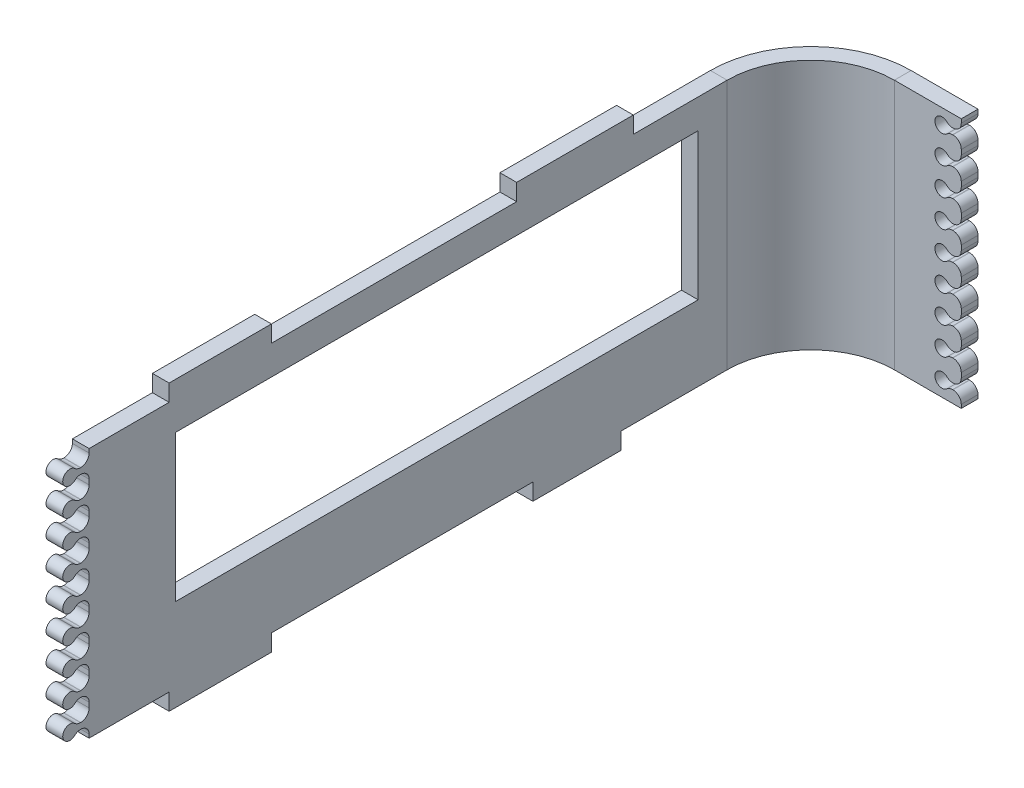
from build123d import *

# Parameters (mm, degrees)
BOSS_EXTRUDE1_DEPTH          = 5.08
EDGE_FLANGE1_STRIP_W         = 76.2
EDGE_FLANGE1_STRIP_H         = 5.08
EDGE_FLANGE1_STRIP_CUT_DEPTH = 76.2
EDGE_FLANGE1_DEPTH           = 76.2
EDGE_FLANGE1_START           = 5.08
EDGE_FLANGE1_FLAT_DEPTH      = 5.08
SKETCH8_W                    = 158.75
SKETCH8_H                    = 44.5
CUT_EXTRUDE1_DEPTH           = 242.670544012


# Sheet-metal steps are written as plain solids
with BuildPart() as part:
    # Sketch1 → Boss-Extrude1 (new body)
    with BuildSketch(Plane.XY):
        with BuildLine():
            Line((12.7, -38.1), (12.7, -37.011825379))
            ThreePointArc((12.7, -37.011825379), (11.956051224, -35.215774155), (10.16, -34.471825379))
            Line((10.16, -34.471825379), (10.028134089, -34.471825379))
            ThreePointArc((10.028134089, -34.471825379), (9.111928379, -34.642824093), (8.319084872, -35.132796169))
            ThreePointArc((8.319084872, -35.132796169), (4.69036112, -33.498380336), (8.362360336, -31.963657905))
            ThreePointArc((8.362360336, -31.963657905), (9.173613419, -32.48826627), (10.122080076, -32.6719957))
            Line((10.122080076, -32.6719957), (10.16, -32.6719957))
            ThreePointArc((10.16, -32.6719957), (11.956051224, -31.928046924), (12.7, -30.1319957))
            Line((12.7, -30.1319957), (12.7, -28.629825379))
            ThreePointArc((12.7, -28.629825379), (11.956051224, -26.833774155), (10.16, -26.089825379))
            Line((10.16, -26.089825379), (10.028134089, -26.089825379))
            ThreePointArc((10.028134089, -26.089825379), (9.111928379, -26.260824093), (8.319084872, -26.750796169))
            ThreePointArc((8.319084872, -26.750796169), (4.69036112, -25.116380336), (8.362360336, -23.581657905))
            ThreePointArc((8.362360336, -23.581657905), (9.173613419, -24.10626627), (10.122080076, -24.2899957))
            Line((10.122080076, -24.2899957), (10.16, -24.2899957))
            ThreePointArc((10.16, -24.2899957), (11.956051224, -23.546046924), (12.7, -21.7499957))
            Line((12.7, -21.7499957), (12.7, -20.247825379))
            ThreePointArc((12.7, -20.247825379), (11.956051224, -18.451774155), (10.16, -17.707825379))
            Line((10.16, -17.707825379), (10.028134089, -17.707825379))
            ThreePointArc((10.028134089, -17.707825379), (9.111928379, -17.878824093), (8.319084872, -18.368796169))
            ThreePointArc((8.319084872, -18.368796169), (4.69036112, -16.734380336), (8.362360336, -15.199657905))
            ThreePointArc((8.362360336, -15.199657905), (9.173613419, -15.72426627), (10.122080076, -15.9079957))
            Line((10.122080076, -15.9079957), (10.16, -15.9079957))
            ThreePointArc((10.16, -15.9079957), (11.956051224, -15.164046924), (12.7, -13.3679957))
            Line((12.7, -13.3679957), (12.7, -11.865825379))
            ThreePointArc((12.7, -11.865825379), (11.956051224, -10.069774155), (10.16, -9.325825379))
            Line((10.16, -9.325825379), (10.028134089, -9.325825379))
            ThreePointArc((10.028134089, -9.325825379), (9.111928379, -9.496824093), (8.319084872, -9.986796169))
            ThreePointArc((8.319084872, -9.986796169), (4.69036112, -8.352380336), (8.362360336, -6.817657905))
            ThreePointArc((8.362360336, -6.817657905), (9.173613419, -7.34226627), (10.122080076, -7.5259957))
            Line((10.122080076, -7.5259957), (10.16, -7.5259957))
            ThreePointArc((10.16, -7.5259957), (11.956051224, -6.782046924), (12.7, -4.9859957))
            Line((12.7, -4.9859957), (12.7, -3.483825379))
            ThreePointArc((12.7, -3.483825379), (11.956051224, -1.687774155), (10.16, -0.943825379))
            Line((10.16, -0.943825379), (10.028134089, -0.943825379))
            ThreePointArc((10.028134089, -0.943825379), (9.111928379, -1.114824093), (8.319084872, -1.604796169))
            ThreePointArc((8.319084872, -1.604796169), (4.69036112, 0.029619664), (8.362360336, 1.564342095))
            ThreePointArc((8.362360336, 1.564342095), (9.173613419, 1.03973373), (10.122080076, 0.8560043))
            Line((10.122080076, 0.8560043), (10.16, 0.8560043))
            ThreePointArc((10.16, 0.8560043), (11.956051224, 1.599953076), (12.7, 3.3960043))
            Line((12.7, 3.3960043), (12.7, 4.898174621))
            ThreePointArc((12.7, 4.898174621), (11.956051224, 6.694225845), (10.16, 7.438174621))
            Line((10.16, 7.438174621), (10.028134089, 7.438174621))
            ThreePointArc((10.028134089, 7.438174621), (9.111928379, 7.267175907), (8.319084872, 6.777203831))
            ThreePointArc((8.319084872, 6.777203831), (4.69036112, 8.411619664), (8.362360336, 9.946342095))
            ThreePointArc((8.362360336, 9.946342095), (9.173613419, 9.42173373), (10.122080076, 9.2380043))
            Line((10.122080076, 9.2380043), (10.16, 9.2380043))
            ThreePointArc((10.16, 9.2380043), (11.956051224, 9.981953076), (12.7, 11.7780043))
            Line((12.7, 11.7780043), (12.7, 13.280174621))
            ThreePointArc((12.7, 13.280174621), (11.956051224, 15.076225845), (10.16, 15.820174621))
            Line((10.16, 15.820174621), (10.028134089, 15.820174621))
            ThreePointArc((10.028134089, 15.820174621), (9.111928379, 15.649175907), (8.319084872, 15.159203831))
            ThreePointArc((8.319084872, 15.159203831), (4.69036112, 16.793619664), (8.362360336, 18.328342095))
            ThreePointArc((8.362360336, 18.328342095), (9.173613419, 17.80373373), (10.122080076, 17.6200043))
            Line((10.122080076, 17.6200043), (10.16, 17.6200043))
            ThreePointArc((10.16, 17.6200043), (11.956051224, 18.363953076), (12.7, 20.1600043))
            Line((12.7, 20.1600043), (12.7, 21.662174621))
            ThreePointArc((12.7, 21.662174621), (11.956051224, 23.458225845), (10.16, 24.202174621))
            Line((10.16, 24.202174621), (10.028134089, 24.202174621))
            ThreePointArc((10.028134089, 24.202174621), (9.111928379, 24.031175907), (8.319084872, 23.541203831))
            ThreePointArc((8.319084872, 23.541203831), (4.69036112, 25.175619664), (8.362360336, 26.710342095))
            ThreePointArc((8.362360336, 26.710342095), (9.173613419, 26.18573373), (10.122080076, 26.0020043))
            Line((10.122080076, 26.0020043), (10.16, 26.0020043))
            ThreePointArc((10.16, 26.0020043), (11.956051224, 26.745953076), (12.7, 28.5420043))
            Line((12.7, 28.5420043), (12.7, 30.044174621))
            ThreePointArc((12.7, 30.044174621), (11.956051224, 31.840225845), (10.16, 32.584174621))
            Line((10.16, 32.584174621), (10.028134089, 32.584174621))
            ThreePointArc((10.028134089, 32.584174621), (9.111928379, 32.413175907), (8.319084872, 31.923203831))
            ThreePointArc((8.319084872, 31.923203831), (4.69036112, 33.557619664), (8.362360336, 35.092342095))
            ThreePointArc((8.362360336, 35.092342095), (9.173613419, 34.56773373), (10.122080076, 34.3840043))
            Line((10.122080076, 34.3840043), (10.16, 34.3840043))
            ThreePointArc((10.16, 34.3840043), (11.956051224, 35.127953076), (12.7, 36.9240043))
            Line((12.7, 36.9240043), (12.7, 38.1))
            Line((12.7, 38.1), (-12.7, 38.1))
            Line((-12.7, 38.1), (-12.7, -38.1))
            Line((-12.7, -38.1), (12.7, -38.1))
        make_face()
    extrude(amount=BOSS_EXTRUDE1_DEPTH)

    # Edge-Flange1 strip (across the edge) → Edge-Flange1 strip cut (cut)
    with BuildSketch(Plane(origin=(-33.02, 38.1, 5.08), x_dir=(1, 0, 0), z_dir=(0, -1, 0))):
        with Locations((-12.7, -2.54)):
            Rectangle(EDGE_FLANGE1_STRIP_W, EDGE_FLANGE1_STRIP_H)
    extrude(amount=EDGE_FLANGE1_STRIP_CUT_DEPTH, mode=Mode.SUBTRACT)

    # Edge-Flange1 bend section (across the edge) → Edge-Flange1 (add)
    with BuildSketch(Plane(origin=(-33.02, 38.1, 5.08), x_dir=(1, 0, 0), z_dir=(0, -1, 0))):
        with BuildLine():
            Line((-5.08, 25.4), (0, 25.4))
            ThreePointArc((0, 25.4), (7.439487758, 7.439487758), (25.4, 0))
            Line((25.4, 0), (25.4, -5.08))
            ThreePointArc((25.4, -5.08), (3.847385309, 3.847385309), (-5.08, 25.4))
        make_face()
    extrude(amount=EDGE_FLANGE1_DEPTH)

    # Edge-Flange1 profile (on flange) → Edge-Flange1 flat (add)
    with BuildSketch(Plane(origin=(-33.02, 0, 5.08), x_dir=(0, -1, 0), z_dir=(-1, 0, 0)).offset(EDGE_FLANGE1_START)):
        with BuildLine():
            Line((-38.1, 53.890818747), (-38.1, 25.4))
            Line((-38.1, 25.4), (38.1, 25.4))
            Line((38.1, 25.4), (38.1, 57.681212064))
            Line((38.1, 57.681212064), (43.18, 57.681212064))
            Line((43.18, 57.681212064), (43.18, 84.403484947))
            Line((43.18, 84.403484947), (38.1, 84.403484947))
            Line((38.1, 84.403484947), (38.1, 163.812224933))
            Line((38.1, 163.812224933), (43.18, 163.812224933))
            Line((43.18, 163.812224933), (43.18, 194.893450131))
            Line((43.18, 194.893450131), (38.1, 194.893450131))
            Line((38.1, 194.893450131), (38.1, 219.202))
            Line((38.1, 219.202), (37.018011655, 219.202))
            ThreePointArc((37.018011655, 219.202), (35.221960431, 219.945948776), (34.478011655, 221.742))
            Line((34.478011655, 221.742), (34.478011655, 221.779919924))
            ThreePointArc((34.478011655, 221.779919924), (34.661741085, 222.728386581), (35.18634945, 223.539639664))
            ThreePointArc((35.18634945, 223.539639664), (33.651627019, 227.21163888), (32.017211185, 223.582915128))
            ThreePointArc((32.017211185, 223.582915128), (32.507183262, 222.790071621), (32.678181975, 221.873865911))
            Line((32.678181975, 221.873865911), (32.678181975, 221.742))
            ThreePointArc((32.678181975, 221.742), (31.9342332, 219.945948776), (30.138181975, 219.202))
            Line((30.138181975, 219.202), (28.636011655, 219.202))
            ThreePointArc((28.636011655, 219.202), (26.839960431, 219.945948776), (26.096011655, 221.742))
            Line((26.096011655, 221.742), (26.096011655, 221.779919924))
            ThreePointArc((26.096011655, 221.779919924), (26.279741085, 222.728386581), (26.80434945, 223.539639664))
            ThreePointArc((26.80434945, 223.539639664), (25.269627019, 227.21163888), (23.635211185, 223.582915128))
            ThreePointArc((23.635211185, 223.582915128), (24.125183262, 222.790071621), (24.296181975, 221.873865911))
            Line((24.296181975, 221.873865911), (24.296181975, 221.742))
            ThreePointArc((24.296181975, 221.742), (23.5522332, 219.945948776), (21.756181975, 219.202))
            Line((21.756181975, 219.202), (20.254011655, 219.202))
            ThreePointArc((20.254011655, 219.202), (18.457960431, 219.945948776), (17.714011655, 221.742))
            Line((17.714011655, 221.742), (17.714011655, 221.779919924))
            ThreePointArc((17.714011655, 221.779919924), (17.897741085, 222.728386581), (18.42234945, 223.539639664))
            ThreePointArc((18.42234945, 223.539639664), (16.887627019, 227.21163888), (15.253211185, 223.582915128))
            ThreePointArc((15.253211185, 223.582915128), (15.743183262, 222.790071621), (15.914181975, 221.873865911))
            Line((15.914181975, 221.873865911), (15.914181975, 221.742))
            ThreePointArc((15.914181975, 221.742), (15.1702332, 219.945948776), (13.374181975, 219.202))
            Line((13.374181975, 219.202), (11.872011655, 219.202))
            ThreePointArc((11.872011655, 219.202), (10.075960431, 219.945948776), (9.332011655, 221.742))
            Line((9.332011655, 221.742), (9.332011655, 221.779919924))
            ThreePointArc((9.332011655, 221.779919924), (9.515741085, 222.728386581), (10.04034945, 223.539639664))
            ThreePointArc((10.04034945, 223.539639664), (8.505627019, 227.21163888), (6.871211185, 223.582915128))
            ThreePointArc((6.871211185, 223.582915128), (7.361183262, 222.790071621), (7.532181975, 221.873865911))
            Line((7.532181975, 221.873865911), (7.532181975, 221.742))
            ThreePointArc((7.532181975, 221.742), (6.7882332, 219.945948776), (4.992181975, 219.202))
            Line((4.992181975, 219.202), (3.490011655, 219.202))
            ThreePointArc((3.490011655, 219.202), (1.693960431, 219.945948776), (0.950011655, 221.742))
            Line((0.950011655, 221.742), (0.950011655, 221.779919924))
            ThreePointArc((0.950011655, 221.779919924), (1.133741085, 222.728386581), (1.65834945, 223.539639664))
            ThreePointArc((1.65834945, 223.539639664), (0.123627019, 227.21163888), (-1.510788815, 223.582915128))
            ThreePointArc((-1.510788815, 223.582915128), (-1.020816738, 222.790071621), (-0.849818025, 221.873865911))
            Line((-0.849818025, 221.873865911), (-0.849818025, 221.742))
            ThreePointArc((-0.849818025, 221.742), (-1.5937668, 219.945948776), (-3.389818025, 219.202))
            Line((-3.389818025, 219.202), (-4.891988345, 219.202))
            ThreePointArc((-4.891988345, 219.202), (-6.688039569, 219.945948776), (-7.431988345, 221.742))
            Line((-7.431988345, 221.742), (-7.431988345, 221.779919924))
            ThreePointArc((-7.431988345, 221.779919924), (-7.248258915, 222.728386581), (-6.72365055, 223.539639664))
            ThreePointArc((-6.72365055, 223.539639664), (-8.258372981, 227.21163888), (-9.892788815, 223.582915128))
            ThreePointArc((-9.892788815, 223.582915128), (-9.402816738, 222.790071621), (-9.231818025, 221.873865911))
            Line((-9.231818025, 221.873865911), (-9.231818025, 221.742))
            ThreePointArc((-9.231818025, 221.742), (-9.9757668, 219.945948776), (-11.771818025, 219.202))
            Line((-11.771818025, 219.202), (-13.273988345, 219.202))
            ThreePointArc((-13.273988345, 219.202), (-15.070039569, 219.945948776), (-15.813988345, 221.742))
            Line((-15.813988345, 221.742), (-15.813988345, 221.779919924))
            ThreePointArc((-15.813988345, 221.779919924), (-15.630258915, 222.728386581), (-15.10565055, 223.539639664))
            ThreePointArc((-15.10565055, 223.539639664), (-16.640372981, 227.21163888), (-18.274788815, 223.582915128))
            ThreePointArc((-18.274788815, 223.582915128), (-17.784816738, 222.790071621), (-17.613818025, 221.873865911))
            Line((-17.613818025, 221.873865911), (-17.613818025, 221.742))
            ThreePointArc((-17.613818025, 221.742), (-18.3577668, 219.945948776), (-20.153818025, 219.202))
            Line((-20.153818025, 219.202), (-21.655988345, 219.202))
            ThreePointArc((-21.655988345, 219.202), (-23.452039569, 219.945948776), (-24.195988345, 221.742))
            Line((-24.195988345, 221.742), (-24.195988345, 221.779919924))
            ThreePointArc((-24.195988345, 221.779919924), (-24.012258915, 222.728386581), (-23.48765055, 223.539639664))
            ThreePointArc((-23.48765055, 223.539639664), (-25.022372981, 227.21163888), (-26.656788815, 223.582915128))
            ThreePointArc((-26.656788815, 223.582915128), (-26.166816738, 222.790071621), (-25.995818025, 221.873865911))
            Line((-25.995818025, 221.873865911), (-25.995818025, 221.742))
            ThreePointArc((-25.995818025, 221.742), (-26.7397668, 219.945948776), (-28.535818025, 219.202))
            Line((-28.535818025, 219.202), (-30.037988345, 219.202))
            ThreePointArc((-30.037988345, 219.202), (-31.834039569, 219.945948776), (-32.577988345, 221.742))
            Line((-32.577988345, 221.742), (-32.577988345, 221.779919924))
            ThreePointArc((-32.577988345, 221.779919924), (-32.394258915, 222.728386581), (-31.86965055, 223.539639664))
            ThreePointArc((-31.86965055, 223.539639664), (-33.404372981, 227.21163888), (-35.038788815, 223.582915128))
            ThreePointArc((-35.038788815, 223.582915128), (-34.548816738, 222.790071621), (-34.377818025, 221.873865911))
            Line((-34.377818025, 221.873865911), (-34.377818025, 221.742))
            ThreePointArc((-34.377818025, 221.742), (-35.1217668, 219.945948776), (-36.917818025, 219.202))
            Line((-36.917818025, 219.202), (-38.1, 219.202))
            Line((-38.1, 219.202), (-38.1, 194.893450131))
            Line((-38.1, 194.893450131), (-43.18, 194.893450131))
            Line((-43.18, 194.893450131), (-43.18, 163.812224933))
            Line((-43.18, 163.812224933), (-38.1, 163.812224933))
            Line((-38.1, 163.812224933), (-38.1, 89.330996259))
            Line((-38.1, 89.330996259), (-43.18, 89.330996259))
            Line((-43.18, 89.330996259), (-43.18, 53.890818747))
            Line((-43.18, 53.890818747), (-38.1, 53.890818747))
        make_face()
    extrude(amount=-EDGE_FLANGE1_FLAT_DEPTH)

    # Sketch8 → Cut-Extrude1 (cut, through all)
    with BuildSketch(Plane.ZY.offset(38.1)):
        with Locations((118.645, 6.96)):
            Rectangle(SKETCH8_W, SKETCH8_H)
    extrude(amount=-CUT_EXTRUDE1_DEPTH, mode=Mode.SUBTRACT)


solid = part.part
